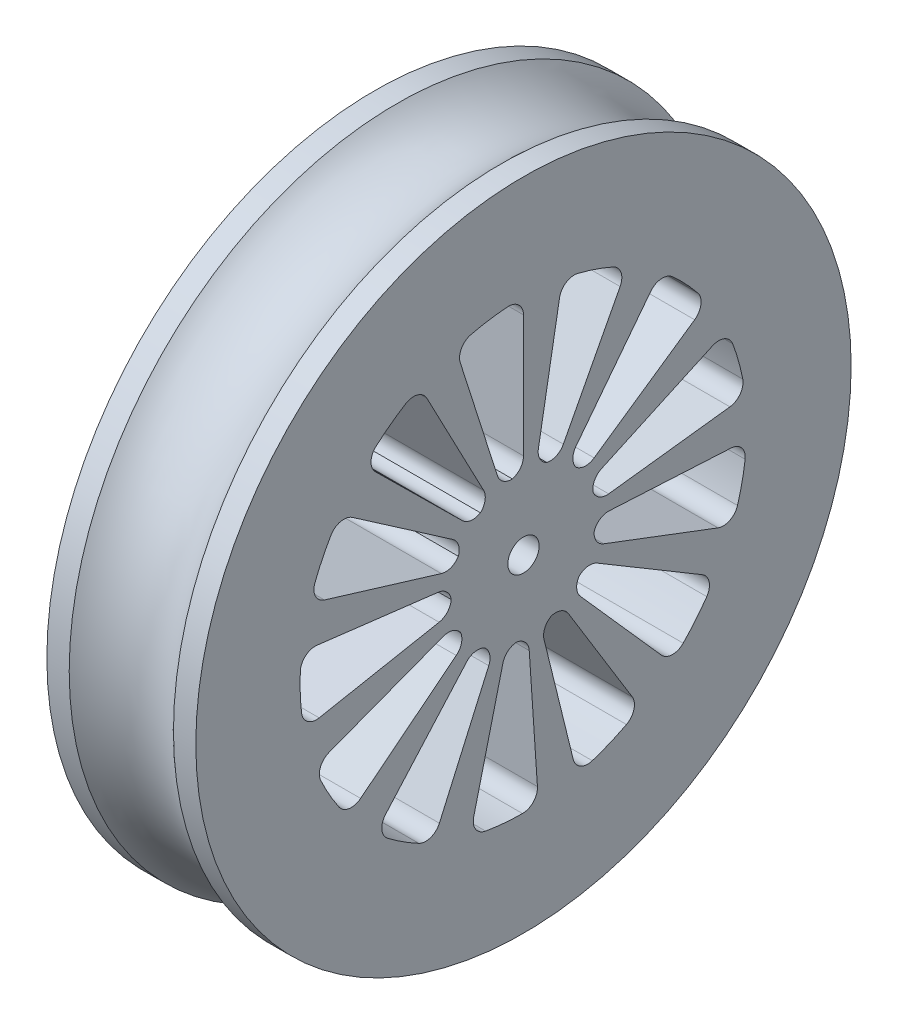
from build123d import *

# Parameters (mm, degrees)
SKETCH2_R          = 1.05
CUT_EXTRUDE1_DEPTH = 10
CUT_EXTRUDE2_DEPTH = 33.680269277
FILLET1_R          = 1


with BuildPart() as part:
    # Sketch1 → Revolve2 (revolve)
    with BuildSketch(Plane.XY, mode=Mode.PRIVATE) as revolve2_sk:
        with BuildLine():
            Line((0, 0), (10, 0))
            Line((10, 0), (10, 22))
            Line((10, 22), (8.5, 22))
            ThreePointArc((8.5, 22), (5, 20.570714214), (1.5, 22))
            Line((1.5, 22), (0, 22))
            Line((0, 22), (0, 0))
        make_face()
    revolve(revolve2_sk.sketch.rotate(Axis((0, 0, 0), (1, 0, 0)), 90), axis=Axis((0, 0, 0), (1, 0, 0)))

    # Sketch2 → Cut-Extrude1 (cut)
    with BuildSketch(Plane(origin=(10, 0, 0), x_dir=(0, 0, -1), z_dir=(1, 0, 0))):
        Circle(SKETCH2_R)
    extrude(amount=-CUT_EXTRUDE1_DEPTH, mode=Mode.SUBTRACT)

    # Sketch3 → Cut-Extrude2 (cut, through all)
    with BuildSketch(Plane(origin=(10, 0, 0), x_dir=(0, 0, -1), z_dir=(1, 0, 0))):
        with BuildLine():
            Line((2.604722665, 14.772116295), (0.84225046, 4.776639722))
            ThreePointArc((0.84225046, 4.776639722), (1.566792192, 4.590297931), (2.25405939, 4.294751347))
            Line((2.25405939, 4.294751347), (6.970847581, 13.281840385))
            ThreePointArc((6.970847581, 13.281840385), (4.845422268, 14.195840343), (2.604722665, 14.772116295))
        make_face()
        with BuildLine():
            Line((9.171312121, 11.869584406), (2.965590908, 3.838091119))
            ThreePointArc((2.965590908, 3.838091119), (3.520543403, 3.336382325), (3.991740938, 2.755299829))
            Line((3.991740938, 2.755299829), (12.344757988, 8.520971201))
            ThreePointArc((12.344757988, 8.520971201), (10.887544298, 10.318012365), (9.171312121, 11.869584406))
        make_face()
        with BuildLine():
            Line((13.636864497, 6.247873773), (4.409550218, 2.020282094))
            ThreePointArc((4.409550218, 2.020282094), (4.667780547, 1.318141736), (4.814962743, 0.584642325))
            Line((4.814962743, 0.584642325), (14.890633111, 1.808050204))
            ThreePointArc((14.890633111, 1.808050204), (14.435461139, 4.076452099), (13.636864497, 6.247873773))
        make_face()
        with BuildLine():
            Line((14.978375558, -0.805149446), (4.843334715, -0.260349211))
            ThreePointArc((4.843334715, -0.260349211), (4.74568542, -1.002069239), (4.53513461, -1.719949689))
            Line((4.53513461, -1.719949689), (14.02524364, -5.319073306))
            ThreePointArc((14.02524364, -5.319073306), (14.676387798, -3.098974216), (14.978375558, -0.805149446))
        make_face()
        with BuildLine():
            Line((12.888521288, -7.67372263), (4.167569596, -2.48133765))
            ThreePointArc((4.167569596, -2.48133765), (3.736410956, -3.092718228), (3.216361792, -3.630521958))
            Line((3.216361792, -3.630521958), (9.946839874, -11.227661223))
            ThreePointArc((9.946839874, -11.227661223), (11.555130883, -9.564462885), (12.888521288, -7.67372263))
        make_face()
        with BuildLine():
            Line((7.846062115, -12.784338438), (2.537064508, -4.133881536))
            ThreePointArc((2.537064508, -4.133881536), (1.87116977, -4.474862742), (1.160759249, -4.709385399))
            Line((1.160759249, -4.709385399), (3.589734964, -14.564127261))
            ThreePointArc((3.589734964, -14.564127261), (5.786732737, -13.838848371), (7.846062115, -12.784338438))
        make_face()
        with BuildLine():
            ThreePointArc((0.325348516, -4.839402981), (-0.42273386, -4.83187013), (-1.160759249, -4.709385399))
            Line((-1.160759249, -4.709385399), (-3.589734964, -14.564127261))
            ThreePointArc((-3.589734964, -14.564127261), (-1.307336141, -14.942920471), (1.006164666, -14.966216378))
            Line((1.006164666, -14.966216378), (0.325348516, -4.839402981))
        make_face()
        with BuildLine():
            ThreePointArc((-1.9609009, -4.436275524), (-2.619794257, -4.081954301), (-3.216361792, -3.630521958))
            Line((-3.216361792, -3.630521958), (-9.946839874, -11.227661223))
            ThreePointArc((-9.946839874, -11.227661223), (-8.101910065, -12.623749574), (-6.064232982, -13.719514508))
            Line((-6.064232982, -13.719514508), (-1.9609009, -4.436275524))
        make_face()
        with BuildLine():
            ThreePointArc((-3.797931552, -3.016850808), (-4.216691362, -2.396911935), (-4.53513461, -1.719949689))
            Line((-4.53513461, -1.719949689), (-14.02524364, -5.319073306))
            ThreePointArc((-14.02524364, -5.319073306), (-13.040434031, -7.412629781), (-11.745387936, -9.329837203))
            Line((-11.745387936, -9.329837203), (-3.797931552, -3.016850808))
        make_face()
        with BuildLine():
            ThreePointArc((-4.764901855, -0.906301928), (-4.847595293, -0.162765931), (-4.814962743, 0.584642325))
            Line((-4.814962743, 0.584642325), (-14.890633111, 1.808050204))
            ThreePointArc((-14.890633111, 1.808050204), (-14.991551715, -0.503365838), (-14.735816061, -2.802806631))
            Line((-14.735816061, -2.802806631), (-4.764901855, -0.906301928))
        make_face()
        with BuildLine():
            ThreePointArc((-4.640290566, 1.411869801), (-4.367973561, 2.108667787), (-3.991740938, 2.755299829))
            Line((-3.991740938, 2.755299829), (-12.344757988, 8.520971201))
            ThreePointArc((-12.344757988, 8.520971201), (-13.508285569, 6.521213153), (-14.350446312, 4.366313163))
            Line((-14.350446312, 4.366313163), (-4.640290566, 1.411869801))
        make_face()
        with BuildLine():
            ThreePointArc((-3.45264463, 3.406599173), (-2.887701727, 3.897031127), (-2.25405939, 4.294751347))
            Line((-2.25405939, 4.294751347), (-6.970847581, 13.281840385))
            ThreePointArc((-6.970847581, 13.281840385), (-8.930433992, 12.051860799), (-10.677562255, 10.53516323))
            Line((-10.677562255, 10.53516323), (-3.45264463, 3.406599173))
        make_face()
        with BuildLine():
            ThreePointArc((-1.474039418, 4.620917729), (-0.745892228, 4.7926316), (0, 4.850327089))
            Line((0, 4.850327089), (0, 15))
            ThreePointArc((0, 15), (-2.30672761, 14.821572377), (-4.558577364, 14.290534364))
            Line((-4.558577364, 14.290534364), (-1.474039418, 4.620917729))
        make_face()
    extrude(amount=-CUT_EXTRUDE2_DEPTH, mode=Mode.SUBTRACT)

    # Fillet1
    # the kernel refuses this fillet: 1 mm, written as the material it adds along each edge
    with BuildSketch(Plane(origin=(10, 14.290534364, 4.558577364), x_dir=(0, 0.26966420058726454, -0.9629544220375291), z_dir=(-1, 0, 0)), Plane(origin=(10, 10.53516323, 10.677562255), x_dir=(0, 0.6862830248559348, -0.7273345927388495), z_dir=(-1, 0, 0)), Plane(origin=(10, 4.366313163, 14.350446312), x_dir=(0, 0.9456826787369845, -0.3250911735757235), z_dir=(-1, 0, 0))) as fillet1_piece_1:
        with BuildLine():
            CenterArc((1.036376297, 0.999361225), FILLET1_R, 177.951978121, 94.096043758)
            Line((0.037015071, 1.035098339), (0, 0))
            ThreePointArc((0, 0), (0.536056705, -0.00958162), (1.07211341, 0))
        make_face()
    extrude(amount=10)
    with BuildSketch(Plane(origin=(10, 14.772116295, -2.604722665), x_dir=(0, -0.9848077530122082, 0.17364817766692997), z_dir=(-1, 0, 0)), Plane(origin=(10, 11.869584406, -9.171312121), x_dir=(0, -0.7913056270696629, 0.6114208080920107), z_dir=(-1, 0, 0)), Plane(origin=(10, -0.805149446, -14.978375558), x_dir=(0, 0.05367662970312148, 0.9985583705641419), z_dir=(-1, 0, 0)), Plane(origin=(10, 6.247873773, -13.636864497), x_dir=(0, -0.4165249182320387, 0.9091242998027241), z_dir=(-1, 0, 0)), Plane(origin=(10, -2.802806631, 14.735816061), x_dir=(0, 0.18685377538420386, -0.9823877374156649), z_dir=(-1, 0, 0)), Plane(origin=(10, -9.329837203, 11.745387936), x_dir=(0, 0.6219891468387043, -0.7830258624176221), z_dir=(-1, 0, 0)), Plane(origin=(10, -13.719514508, 6.064232982), x_dir=(0, 0.9146343005342535, -0.40428219882430744), z_dir=(-1, 0, 0)), Plane(origin=(10, -14.966216378, -1.006164666), x_dir=(0, 0.9977477585156255, 0.06707764439099849), z_dir=(-1, 0, 0)), Plane(origin=(10, -12.784338438, -7.846062115), x_dir=(0, 0.8522892291850337, 0.523070807649577), z_dir=(-1, 0, 0)), Plane(origin=(10, -7.67372263, -12.888521288), x_dir=(0, 0.5115815086468098, 0.859234752562217), z_dir=(-1, 0, 0))) as fillet1_piece_2:
        with BuildLine():
            CenterArc((1.035759956, -1), FILLET1_R, 90, 94.096043758)
            ThreePointArc((0.038314239, -1.071428571), (0.00958162, -0.536056705), (0, 0))
            Line((0, 0), (1.035759956, 0))
        make_face()
    extrude(amount=10)
    with BuildSketch(Plane(origin=(10, 1.808050204, 14.890633111), x_dir=(0, -0.9963823898655443, 0.08498313459638004), z_dir=(-1, 0, 0)), Plane(origin=(10, -5.319073306, 14.02524364), x_dir=(0, -0.9217464228410107, -0.38779315617968374), z_dir=(-1, 0, 0)), Plane(origin=(10, -14.564127261, 3.589734964), x_dir=(0, -0.20446413740132124, -0.9788740554927041), z_dir=(-1, 0, 0)), Plane(origin=(10, 1.808050204, -14.890633111), x_dir=(0, 0.9877671237764138, 0.15593623436030185), z_dir=(-1, 0, 0)), Plane(origin=(10, 8.520971201, -12.344757988), x_dir=(0, 0.8021571702215626, 0.5971129493338215), z_dir=(-1, 0, 0)), Plane(origin=(10, 15, 0), x_dir=(0, -0.03573711367703827, 0.9993612253364819), z_dir=(-1, 0, 0)), Plane(origin=(10, 13.281840385, 6.970847581), x_dir=(0, -0.49606996130055675, 0.8682825539507656), z_dir=(-1, 0, 0)), Plane(origin=(10, 8.520971201, 12.344757988), x_dir=(0, -0.8427591590813438, 0.5382908133941227), z_dir=(-1, 0, 0)), Plane(origin=(10, -11.227661223, -9.946839874), x_dir=(0, 0.6894486859841403, -0.7243345286500862), z_dir=(-1, 0, 0))) as fillet1_piece_3:
        with BuildLine():
            CenterArc((1.036376297, -0.999361225), FILLET1_R, 87.951978121, 94.096043758)
            Line((0.037015071, -1.035098339), (0, 0))
            ThreePointArc((0, 0), (0.536056705, 0.00958162), (1.07211341, 0))
        make_face()
    extrude(amount=10)
    with BuildSketch(Plane(origin=(10, -11.227661223, 9.946839874), x_dir=(0, 0.7485107481710997, -0.6631226582407966), z_dir=(-1, 0, 0)), Plane(origin=(10, -14.564127261, -3.589734964), x_dir=(0, 0.9709418174260528, 0.23931566428755488), z_dir=(-1, 0, 0)), Plane(origin=(10, -5.319073306, -14.02524364), x_dir=(0, 0.35460488704253845, 0.9350162426854137), z_dir=(-1, 0, 0)), Plane(origin=(10, 13.281840385, -6.970847581), x_dir=(0, -0.8854560256532109, 0.4647231720437667), z_dir=(-1, 0, 0))) as fillet1_piece_4:
        with BuildLine():
            CenterArc((1.035759956, 1), FILLET1_R, 175.903956242, 94.096043758)
            ThreePointArc((0.038314239, 1.071428571), (0.00958162, 0.536056705), (0, 0))
            Line((0, 0), (1.035759956, 0))
        make_face()
    extrude(amount=10)
    with BuildSketch(Plane(origin=(10, 4.620917729, 1.474039418), x_dir=(0, 0.22106072386394496, -0.9752600455082473), z_dir=(-1, 0, 0)), Plane(origin=(10, 3.406599173, 3.45264463), x_dir=(0, 0.6489654918969179, -0.7608178430655997), z_dir=(-1, 0, 0)), Plane(origin=(10, 1.411869801, 4.640290566), x_dir=(0, 0.9282000866181308, -0.3720814416254783), z_dir=(-1, 0, 0)), Plane(origin=(10, -3.016850808, 3.797931552), x_dir=(0, 0.8334947703768036, 0.5525273457074493), z_dir=(-1, 0, 0)), Plane(origin=(10, -4.436275524, 1.9609009), x_dir=(0, 0.4812507060426553, 0.8765830011661448), z_dir=(-1, 0, 0)), Plane(origin=(10, -4.133881536, -2.537064508), x_dir=(0, -0.44803210663360266, 0.8940174670695512), z_dir=(-1, 0, 0)), Plane(origin=(10, -2.48133765, -4.167569596), x_dir=(0, -0.8121833616638006, 0.5834022514839039), z_dir=(-1, 0, 0)), Plane(origin=(10, -0.260349211, -4.843334715), x_dir=(0, -0.990273196407553, 0.13913661084260984), z_dir=(-1, 0, 0)), Plane(origin=(10, 2.020282094, -4.409550218), x_dir=(0, -0.9415033759401247, -0.3370035505648989), z_dir=(-1, 0, 0)), Plane(origin=(10, 4.776639722, -0.84225046), x_dir=(0, -0.2574863919358113, -0.9662819246823765), z_dir=(-1, 0, 0)), Plane(origin=(10, 3.838091119, -2.965590908), x_dir=(0, -0.677046478390387, -0.7359402598711225), z_dir=(-1, 0, 0))) as fillet1_piece_5:
        with BuildLine():
            CenterArc((0.917918164, -0.996313974), FILLET1_R, 94.920965652, 80.158068696)
            Line((-0.07839581, -0.910532474), (0, 0))
            ThreePointArc((0, 0), (0.416068332, -0.017878433), (0.832136664, 0))
        make_face()
    extrude(amount=10)
    with BuildSketch(Plane(origin=(10, 4.850327089, 0), x_dir=(0, 1, 0), z_dir=(-1, 0, 0)), Plane(origin=(10, 4.294751347, 2.25405939), x_dir=(0, 0.8854560256532094, 0.46472317204376956), z_dir=(-1, 0, 0)), Plane(origin=(10, 2.755299829, 3.991740938), x_dir=(0, 0.5680647467311564, 0.822983865893656), z_dir=(-1, 0, 0)), Plane(origin=(10, 0.584642325, 4.814962743), x_dir=(0, 0.12053668025532241, 0.9927088740980541), z_dir=(-1, 0, 0)), Plane(origin=(10, -3.630521958, 3.216361792), x_dir=(0, -0.7485107481711016, 0.6631226582407946), z_dir=(-1, 0, 0)), Plane(origin=(10, -4.709385399, 1.160759249), x_dir=(0, -0.9709418174260522, 0.23931566428755724), z_dir=(-1, 0, 0)), Plane(origin=(10, -4.709385399, -1.160759249), x_dir=(0, -0.9709418174260516, -0.23931566428755952), z_dir=(-1, 0, 0)), Plane(origin=(10, -1.719949689, -4.53513461), x_dir=(0, -0.354604887042536, -0.9350162426854146), z_dir=(-1, 0, 0)), Plane(origin=(10, 4.294751347, -2.25405939), x_dir=(0, 0.8854560256532098, -0.4647231720437688), z_dir=(-1, 0, 0))) as fillet1_piece_6:
        with BuildLine():
            CenterArc((0.913901138, -1), FILLET1_R, 90, 80.158068696)
            ThreePointArc((-0.071381931, -0.829069386), (-0.017878433, -0.416068332), (0, 0))
            Line((0, 0), (0.913901138, 0))
        make_face()
    extrude(amount=10)
    with BuildSketch(Plane(origin=(10, -0.906301928, 4.764901855), x_dir=(0, -0.18685377538420458, 0.9823877374156648), z_dir=(-1, 0, 0)), Plane(origin=(10, -4.839402981, -0.325348516), x_dir=(0, -0.9977477585156251, -0.0670776443910017), z_dir=(-1, 0, 0))) as fillet1_piece_7:
        with BuildLine():
            CenterArc((0.913901138, 1), FILLET1_R, 189.841931304, 80.158068696)
            ThreePointArc((-0.071381931, 0.829069386), (-0.017878433, 0.416068332), (0, 0))
            Line((0, 0), (0.913901138, 0))
        make_face()
    extrude(amount=10)
    with BuildSketch(Plane(origin=(10, -1.719949689, 4.53513461), x_dir=(0, -0.9011512092511582, -0.4335048997014627), z_dir=(-1, 0, 0)), Plane(origin=(10, -3.630521958, -3.216361792), x_dir=(0, 0.7248867452699457, -0.6888680617737659), z_dir=(-1, 0, 0)), Plane(origin=(10, 0.584642325, -4.814962743), x_dir=(0, 0.9787099059298004, 0.2052484349145714), z_dir=(-1, 0, 0)), Plane(origin=(10, 2.755299829, -3.991740938), x_dir=(0, 0.7712208798416369, 0.6365676354451987), z_dir=(-1, 0, 0))) as fillet1_piece_8:
        with BuildLine():
            CenterArc((0.917918164, 0.996313974), FILLET1_R, 184.920965652, 80.158068696)
            Line((-0.07839581, 0.910532474), (0, 0))
            ThreePointArc((0, 0), (0.416068332, 0.017878433), (0.832136664, 0))
        make_face()
    extrude(amount=10)


solid = part.part
